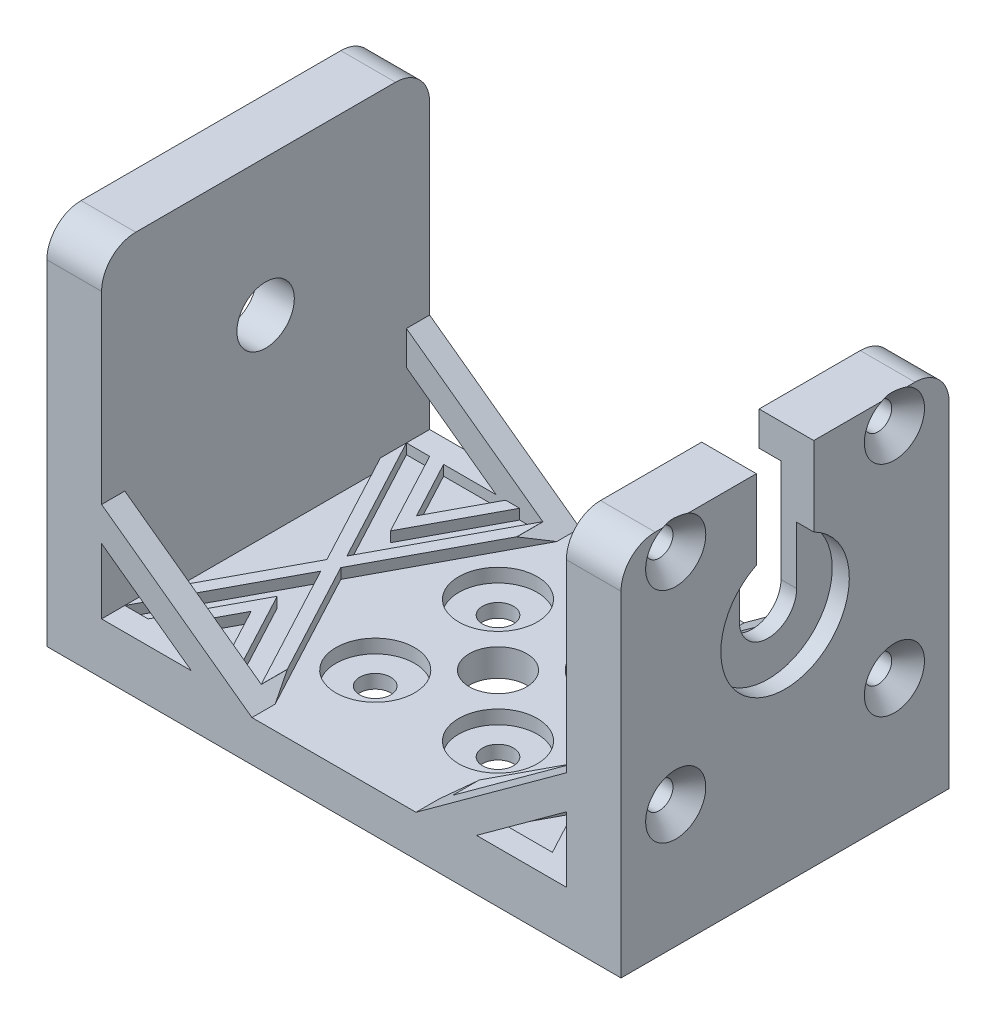
from build123d import *

# Parameters (mm, degrees)
SKETCH1_W           = 42
SKETCH1_H           = 24
BOSS_EXTRUDE1_DEPTH = 3
SKETCH2_W           = 4
SKETCH2_H           = 24
BOSS_EXTRUDE2_DEPTH = 24
SKETCH3_R           = 2.1
CUT_EXTRUDE1_DEPTH  = 52.351728306
SKETCH4_R           = 7.8
CUT_EXTRUDE2_DEPTH  = 1.6
CUT_EXTRUDE3_REACH  = 53.352
SKETCH5_R           = 1
CHAMFER1_SIZE       = 1.2
FILLET1_R           = 2.5
FILLET2_R           = 2.5
FILLET3_R           = 2.5
FILLET4_R           = 2.5
CUT_EXTRUDE4_REACH  = 38.249
SKETCH6_R           = 2.1
SKETCH7_R           = 4.7
CUT_EXTRUDE5_DEPTH  = 1.25
BOSS_EXTRUDE3_DEPTH = 1.6999
CUT_EXTRUDE6_REACH  = 53.352
BOSS_EXTRUDE4_DEPTH = 1.6999
SKETCH12_R          = 9.6
CUT_EXTRUDE7_DEPTH  = 1
CUT_EXTRUDE8_REACH  = 37.511
SKETCH13_R          = 1.1303
BOSS_EXTRUDE5_DEPTH = 0.75
CUT_EXTRUDE9_DEPTH  = 41.832517189
CUT_EXTRUDE10_DEPTH = 41.832517189
CUT_EXTRUDE11_DEPTH = 42.785164832
SKETCH19_R          = 2.875
CUT_EXTRUDE12_DEPTH = 1


with BuildPart() as part:
    # Sketch1 → Boss-Extrude1 (new body)
    with BuildSketch(Plane(origin=(0, 0, 0), x_dir=(1, 0, 0), z_dir=(0, 1, 0))):
        Rectangle(SKETCH1_W, SKETCH1_H)
    extrude(amount=BOSS_EXTRUDE1_DEPTH)

    # Sketch2 → Boss-Extrude2 (add)
    with BuildSketch(Plane(origin=(0, 3, 0), x_dir=(1, 0, 0), z_dir=(0, 1, 0))):
        with Locations((19, 0)):
            Rectangle(SKETCH2_W, SKETCH2_H)
        with Locations((-19, 0)):
            Rectangle(SKETCH2_W, SKETCH2_H)
    extrude(amount=BOSS_EXTRUDE2_DEPTH)

    # Sketch3 → Cut-Extrude1 (cut, through all)
    with BuildSketch(Plane(origin=(21, 0, 0), x_dir=(0, 0, -1), z_dir=(1, 0, 0))):
        with Locations((0, 17)):
            Circle(SKETCH3_R)
    extrude(amount=-CUT_EXTRUDE1_DEPTH, mode=Mode.SUBTRACT)

    # Sketch4 → Cut-Extrude2 (cut)
    with BuildSketch(Plane.ZY.offset(-17)):
        with Locations((0, 17)):
            Circle(SKETCH4_R)
    extrude(amount=-CUT_EXTRUDE2_DEPTH, mode=Mode.SUBTRACT)

    # Sketch5 → Cut-Extrude3 (cut, up to next)
    with BuildSketch(Plane(origin=(21, 0, 0), x_dir=(0, 0, -1), z_dir=(1, 0, 0)), mode=Mode.PRIVATE) as cut_extrude3_sk1:
        with Locations((-8, 25)):
            Circle(SKETCH5_R)
    cut_extrude3_tool1 = extrude(cut_extrude3_sk1.sketch, amount=-CUT_EXTRUDE3_REACH, mode=Mode.PRIVATE) & part.part
    # Sketch5 → Cut-Extrude3 (cut, up to next)
    with BuildSketch(Plane(origin=(21, 0, 0), x_dir=(0, 0, -1), z_dir=(1, 0, 0)), mode=Mode.PRIVATE) as cut_extrude3_sk2:
        with Locations((8, 25)):
            Circle(SKETCH5_R)
    cut_extrude3_tool2 = extrude(cut_extrude3_sk2.sketch, amount=-CUT_EXTRUDE3_REACH, mode=Mode.PRIVATE) & part.part
    # Sketch5 → Cut-Extrude3 (cut, up to next)
    with BuildSketch(Plane(origin=(21, 0, 0), x_dir=(0, 0, -1), z_dir=(1, 0, 0)), mode=Mode.PRIVATE) as cut_extrude3_sk3:
        with Locations((8, 9)):
            Circle(SKETCH5_R)
    cut_extrude3_tool3 = extrude(cut_extrude3_sk3.sketch, amount=-CUT_EXTRUDE3_REACH, mode=Mode.PRIVATE) & part.part
    # Sketch5 → Cut-Extrude3 (cut, up to next)
    with BuildSketch(Plane(origin=(21, 0, 0), x_dir=(0, 0, -1), z_dir=(1, 0, 0)), mode=Mode.PRIVATE) as cut_extrude3_sk4:
        with Locations((-8, 9)):
            Circle(SKETCH5_R)
    cut_extrude3_tool4 = extrude(cut_extrude3_sk4.sketch, amount=-CUT_EXTRUDE3_REACH, mode=Mode.PRIVATE) & part.part
    add(cut_extrude3_tool1.solids().sort_by_distance((21, 25, 8))[0], mode=Mode.SUBTRACT)
    add(cut_extrude3_tool2.solids().sort_by_distance((21, 25, -8))[0], mode=Mode.SUBTRACT)
    add(cut_extrude3_tool3.solids().sort_by_distance((21, 9, -8))[0], mode=Mode.SUBTRACT)
    add(cut_extrude3_tool4.solids().sort_by_distance((21, 9, 8))[0], mode=Mode.SUBTRACT)

    # Chamfer1
    # the kernel refuses this chamfer: 1.2 mm, written as the material it takes off along each edge
    with BuildSketch(Plane(origin=(21, 9, 8), x_dir=(0, 0, -1), z_dir=(0, -1, 0))) as chamfer1_piece_1:
        Polygon((1 + CHAMFER1_SIZE, 0), (1, -CHAMFER1_SIZE), (1, 0), align=None)
    revolve(axis=Axis((21, 9, 8), (1, 0, 0)), mode=Mode.SUBTRACT)
    with BuildSketch(Plane(origin=(21, 9, -8), x_dir=(0, 0, -1), z_dir=(0, -1, 0))) as chamfer1_piece_2:
        Polygon((1 + CHAMFER1_SIZE, 0), (1, -CHAMFER1_SIZE), (1, 0), align=None)
    revolve(axis=Axis((21, 9, -8), (1, 0, 0)), mode=Mode.SUBTRACT)
    with BuildSketch(Plane(origin=(21, 25, -8), x_dir=(0, 0, -1), z_dir=(0, -1, 0))) as chamfer1_piece_3:
        Polygon((1 + CHAMFER1_SIZE, 0), (1, -CHAMFER1_SIZE), (1, 0), align=None)
    revolve(axis=Axis((21, 25, -8), (1, 0, 0)), mode=Mode.SUBTRACT)
    with BuildSketch(Plane(origin=(21, 25, 8), x_dir=(0, 0, -1), z_dir=(0, -1, 0))) as chamfer1_piece_4:
        Polygon((1 + CHAMFER1_SIZE, 0), (1, -CHAMFER1_SIZE), (1, 0), align=None)
    revolve(axis=Axis((21, 25, 8), (1, 0, 0)), mode=Mode.SUBTRACT)

    # Fillet1
    fillet1_edges = [part.edges().sort_by_distance(p)[0] for p in [
        (19, 27, 12),
    ]]
    fillet(fillet1_edges, radius=FILLET1_R)

    # Fillet2
    fillet2_edges = [part.edges().sort_by_distance(p)[0] for p in [
        (19, 27, -12),
    ]]
    fillet(fillet2_edges, radius=FILLET2_R)

    # Fillet3
    fillet3_edges = [part.edges().sort_by_distance(p)[0] for p in [
        (-19, 27, -12),
    ]]
    fillet(fillet3_edges, radius=FILLET3_R)

    # Fillet4
    fillet4_edges = [part.edges().sort_by_distance(p)[0] for p in [
        (-19, 27, 12),
    ]]
    fillet(fillet4_edges, radius=FILLET4_R)

    # Sketch6 → Cut-Extrude4 (cut, up to next)
    with BuildSketch(Plane.XZ, mode=Mode.PRIVATE) as cut_extrude4_sk1:
        with Locations(Location((0, 0, 0), (0, 0, 270))):
            Circle(SKETCH6_R)
    cut_extrude4_tool1 = extrude(cut_extrude4_sk1.sketch, amount=-CUT_EXTRUDE4_REACH, mode=Mode.PRIVATE) & part.part
    add(cut_extrude4_tool1.solids().sort_by_distance((0, 0, 0))[0], mode=Mode.SUBTRACT)

    # Sketch7 → Cut-Extrude5 (cut)
    with BuildSketch(Plane(origin=(21, 0, 0), x_dir=(0, 0, -1), z_dir=(1, 0, 0))):
        with Locations((0, 17)):
            Circle(SKETCH7_R)
    cut_extrude5 = extrude(amount=-CUT_EXTRUDE5_DEPTH, mode=Mode.SUBTRACT)

    # Mirror1: Cut-Extrude5 across plane
    add(cut_extrude5.mirror(Plane(origin=(0, 0, 0), x_dir=(0, 0, 1), z_dir=(1, 0, 0))), mode=Mode.SUBTRACT)

    # Sketch9 → Boss-Extrude3 (add)
    with BuildSketch(Plane.XY.offset(12)):
        Polygon((-17, 3), (-17, 11), (-6, 3), align=None)
        Polygon((17, 11), (6, 3), (17, 3), align=None)
    extrude(amount=-BOSS_EXTRUDE3_DEPTH)

    # Sketch10 → Cut-Extrude6 (cut, up to next)
    with BuildSketch(Plane(origin=(21, 0, 0), x_dir=(0, 0, -1), z_dir=(1, 0, 0)), mode=Mode.PRIVATE) as cut_extrude6_sk1:
        with BuildLine():
            Line((2.1, 17), (2.1, 27))
            Line((2.1, 27), (-2.1, 27))
            Line((-2.1, 27), (-2.1, 17))
            ThreePointArc((-2.1, 17), (0, 14.9), (2.1, 17))
        make_face()
    cut_extrude6_tool1 = extrude(cut_extrude6_sk1.sketch, amount=-CUT_EXTRUDE6_REACH, mode=Mode.PRIVATE) & part.part
    add(cut_extrude6_tool1.solids().sort_by_distance((21, 21.165903, 0))[0], mode=Mode.SUBTRACT)

    # Sketch11 → Boss-Extrude4 (add)
    with BuildSketch(Plane(origin=(0, 0, -12), x_dir=(-1, 0, 0), z_dir=(0, 0, -1))):
        Polygon((-17, 3), (-17, 11), (-6, 3), align=None)
        Polygon((17, 11), (6, 3), (17, 3), align=None)
    extrude(amount=-BOSS_EXTRUDE4_DEPTH)

    # Sketch12 → Cut-Extrude7 (cut)
    with BuildSketch(Plane.XZ):
        with Locations(Location((0, 0, 0), (0, 0, 270))):
            Circle(SKETCH12_R)
    extrude(amount=-CUT_EXTRUDE7_DEPTH, mode=Mode.SUBTRACT)

    # Sketch13 → Cut-Extrude8 (cut, up to next)
    with BuildSketch(Plane.XZ.offset(-1), mode=Mode.PRIVATE) as cut_extrude8_sk1:
        with Locations(Location((-4.49015, 4.49015, 0), (0, 0, 270))):
            Circle(SKETCH13_R)
    cut_extrude8_tool1 = extrude(cut_extrude8_sk1.sketch, amount=-CUT_EXTRUDE8_REACH, mode=Mode.PRIVATE) & part.part
    # Sketch13 → Cut-Extrude8 (cut, up to next)
    with BuildSketch(Plane.XZ.offset(-1), mode=Mode.PRIVATE) as cut_extrude8_sk2:
        with Locations(Location((4.49015, 4.49015, 0), (0, 0, 270))):
            Circle(SKETCH13_R)
    cut_extrude8_tool2 = extrude(cut_extrude8_sk2.sketch, amount=-CUT_EXTRUDE8_REACH, mode=Mode.PRIVATE) & part.part
    # Sketch13 → Cut-Extrude8 (cut, up to next)
    with BuildSketch(Plane.XZ.offset(-1), mode=Mode.PRIVATE) as cut_extrude8_sk3:
        with Locations(Location((4.49015, -4.49015, 0), (0, 0, 270))):
            Circle(SKETCH13_R)
    cut_extrude8_tool3 = extrude(cut_extrude8_sk3.sketch, amount=-CUT_EXTRUDE8_REACH, mode=Mode.PRIVATE) & part.part
    # Sketch13 → Cut-Extrude8 (cut, up to next)
    with BuildSketch(Plane.XZ.offset(-1), mode=Mode.PRIVATE) as cut_extrude8_sk4:
        with Locations(Location((-4.49015, -4.49015, 0), (0, 0, 270))):
            Circle(SKETCH13_R)
    cut_extrude8_tool4 = extrude(cut_extrude8_sk4.sketch, amount=-CUT_EXTRUDE8_REACH, mode=Mode.PRIVATE) & part.part
    add(cut_extrude8_tool1.solids().sort_by_distance((-4.49015, 1, 4.49015))[0], mode=Mode.SUBTRACT)
    add(cut_extrude8_tool2.solids().sort_by_distance((4.49015, 1, 4.49015))[0], mode=Mode.SUBTRACT)
    add(cut_extrude8_tool3.solids().sort_by_distance((4.49015, 1, -4.49015))[0], mode=Mode.SUBTRACT)
    add(cut_extrude8_tool4.solids().sort_by_distance((-4.49015, 1, -4.49015))[0], mode=Mode.SUBTRACT)

    # Sketch14 → Boss-Extrude5 (add)
    with BuildSketch(Plane(origin=(0, 3, 0), x_dir=(1, 0, 0), z_dir=(0, 1, 0))):
        Polygon((-6, 10.3001), (-11.5, 0), (-6, -10.3001), (-7.01769667, -10.3001), (-12.008848335, -0.952943406), (-17, -10.3001), (-17, -8.389390136), (-12.518984365, 0.002411526), (-17, 8.394213188), (-17, 10.3001), (-12.01013603, 0.955354932), (-7.020272061, 10.3001), align=None)
        Polygon((-9.738422165, -10.3001), (-12.008848335, -6.048169711), (-14.279274505, -10.3001), (-15.296971174, -10.3001), (-14.882917623, -9.519860041), (-12.01013603, -4.139871373), (-8.720725495, -10.3001), align=None)
        Polygon((-8.720725495, 10.3001), (-9.740997556, 10.3001), (-12.01013603, 6.050581237), (-14.279274505, 10.3001), (-15.296971174, 10.3001), (-12.008848335, 4.142282899), align=None)
        Polygon((14.882917623, -9.519860041), (12.01013603, -4.139871373), (8.720725495, -10.3001), (9.738422165, -10.3001), (12.008848335, -6.048169711), (14.279274505, -10.3001), (15.296971174, -10.3001), align=None)
        Polygon((12.01013603, 6.050581237), (9.740997556, 10.3001), (8.720725495, 10.3001), (12.008848335, 4.142282899), (15.296971174, 10.3001), (14.279274505, 10.3001), align=None)
        Polygon((12.008848335, -0.952943406), (17, -10.3001), (17, -8.389390136), (12.518984365, 0.002411526), (17, 8.394213188), (17, 10.3001), (12.01013603, 0.955354932), (7.020272061, 10.3001), (6, 10.3001), (11.5, 0), (6, -10.3001), (7.01769667, -10.3001), align=None)
    extrude(amount=BOSS_EXTRUDE5_DEPTH)

    # Sketch16 → Cut-Extrude9 (cut, through all)
    with BuildSketch(Plane.XY.offset(10.3001)):
        Polygon((-7.01769667, 3.740143032), (-6, 3), (-6, 3.75), (-7.01769667, 3.75), align=None)
    extrude(amount=-CUT_EXTRUDE9_DEPTH, mode=Mode.SUBTRACT)

    # Sketch17 → Cut-Extrude10 (cut, through all)
    with BuildSketch(Plane.XY.offset(10.3001)):
        Polygon((6, 3), (7.01769667, 3.740143032), (7.01769667, 3.75), (6, 3.75), align=None)
    extrude(amount=-CUT_EXTRUDE10_DEPTH, mode=Mode.SUBTRACT)

    # Sketch18 → Cut-Extrude11 (cut, through all)
    with BuildSketch(Plane(origin=(0, 0, -12), x_dir=(-1, 0, 0), z_dir=(0, 0, -1))):
        Polygon((15.296971174, 3.75), (17, 3.75), (17, 8.527005362), (10.431617627, 3.75), (14.279274505, 3.75), align=None)
        Polygon((-10.431617627, 3.75), (-17, 8.527005362), (-17, 3.75), (-15.296971174, 3.75), (-14.279274505, 3.75), align=None)
    extrude(amount=-CUT_EXTRUDE11_DEPTH, mode=Mode.SUBTRACT)

    # Sketch19 → Cut-Extrude12 (cut)
    with BuildSketch(Plane(origin=(0, 3, 0), x_dir=(1, 0, 0), z_dir=(0, 1, 0))):
        with Locations(Location((-4.49015, -4.49015, 0), (0, 0, 270))):
            Circle(SKETCH19_R)
        with Locations(Location((4.49015, -4.49015, 0), (0, 0, 270))):
            Circle(SKETCH19_R)
        with Locations(Location((-4.49015, 4.49015, 0), (0, 0, 270))):
            Circle(SKETCH19_R)
        with Locations(Location((4.49015, 4.49015, 0), (0, 0, 270))):
            Circle(SKETCH19_R)
    extrude(amount=-CUT_EXTRUDE12_DEPTH, mode=Mode.SUBTRACT)


solid = part.part
